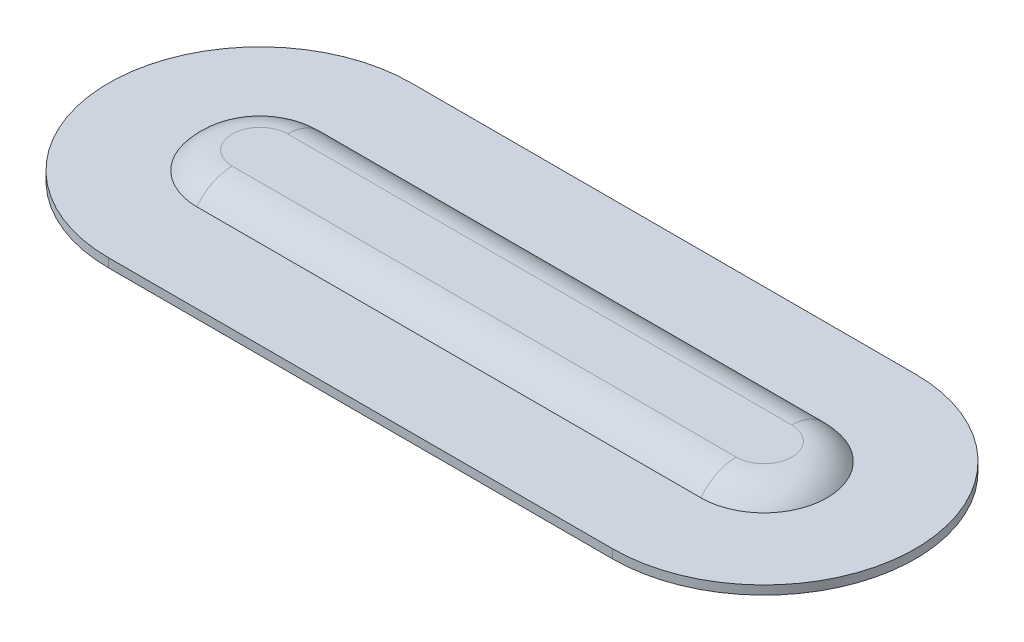
from build123d import *

# Parameters (mm, degrees)
BOSS_EXTRUDE1_DEPTH = 1
BOSS_EXTRUDE2_DEPTH = 2
FILLET1_R           = 5


with BuildPart() as part:
    # Sketch1 → Boss-Extrude1 (new body)
    with BuildSketch(Plane(origin=(0, 0, 0), x_dir=(1, 0, 0), z_dir=(0, 1, 0))):
        with BuildLine():
            Line((-28.55625, 17.14897587), (28.55625, 17.14897587))
            ThreePointArc((28.55625, 17.14897587), (45.70522587, 0), (28.55625, -17.14897587))
            Line((28.55625, -17.14897587), (-28.55625, -17.14897587))
            ThreePointArc((-28.55625, -17.14897587), (-45.70522587, 0), (-28.55625, 17.14897587))
        make_face()
    extrude(amount=BOSS_EXTRUDE1_DEPTH)

    # Sketch2 → Boss-Extrude2 (add)
    with BuildSketch(Plane(origin=(0, 1, 0), x_dir=(1, 0, 0), z_dir=(0, 1, 0))):
        with BuildLine():
            Line((-28.55625, -7.14897587), (28.55625, -7.14897587))
            ThreePointArc((28.55625, -7.14897587), (35.70522587, 0), (28.55625, 7.14897587))
            Line((28.55625, 7.14897587), (-28.55625, 7.14897587))
            ThreePointArc((-28.55625, 7.14897587), (-35.70522587, 0), (-28.55625, -7.14897587))
        make_face()
    extrude(amount=BOSS_EXTRUDE2_DEPTH)

    # Fillet1
    # the kernel refuses this fillet: 5 mm, written as the material it takes off along each edge
    with BuildSketch(Plane(origin=(28.55625, 3, -7.14897587), x_dir=(0, -1, 0), z_dir=(-1, 0, 0)), Plane(origin=(-28.55625, 3, 7.14897587), x_dir=(0, -1, 0), z_dir=(1, 0, 0))) as fillet1_piece_1:
        with BuildLine():
            CenterArc((5, 4), FILLET1_R, 180, 53.130102354)
            Line((0, 4), (-0.1, 4))
            Line((-0.1, 4), (-0.1, 0))
            Line((-0.1, 0), (0, -0.1))
            ThreePointArc((0, -0.1), (1, -0.1), (1.94, -0.08))
            Line((1.94, -0.08), (2, 0))
        make_face()
    extrude(amount=57.1125, mode=Mode.SUBTRACT)
    with BuildSketch(Plane(origin=(28.55625, 3, 0), x_dir=(0, 0, 1), z_dir=(-1, 0, 0))) as fillet1_piece_2:
        with BuildLine():
            CenterArc((3.14897587, -5), FILLET1_R, 36.869897646, 53.130102354)
            Line((3.14897587, 0), (3.14897587, 0.1))
            Line((3.14897587, 0.1), (7.14897587, 0.1))
            Line((7.14897587, 0.1), (7.24897587, 0))
            ThreePointArc((7.24897587, 0), (7.24897587, -1), (7.22897587, -1.94))
            Line((7.22897587, -1.94), (7.14897587, -2))
        make_face()
    revolve(axis=Axis((28.55625, 3, 0), (0, 1, 0)), revolution_arc=180, mode=Mode.SUBTRACT)
    with BuildSketch(Plane(origin=(-28.55625, 3, 0), x_dir=(0, 0, -1), z_dir=(1, 0, 0))) as fillet1_piece_3:
        with BuildLine():
            CenterArc((3.14897587, -5), FILLET1_R, 36.869897646, 53.130102354)
            Line((3.14897587, 0), (3.14897587, 0.1))
            Line((3.14897587, 0.1), (7.14897587, 0.1))
            Line((7.14897587, 0.1), (7.24897587, 0))
            ThreePointArc((7.24897587, 0), (7.24897587, -1), (7.22897587, -1.94))
            Line((7.22897587, -1.94), (7.14897587, -2))
        make_face()
    revolve(axis=Axis((-28.55625, 3, 0), (0, 1, 0)), revolution_arc=180, mode=Mode.SUBTRACT)


solid = part.part
